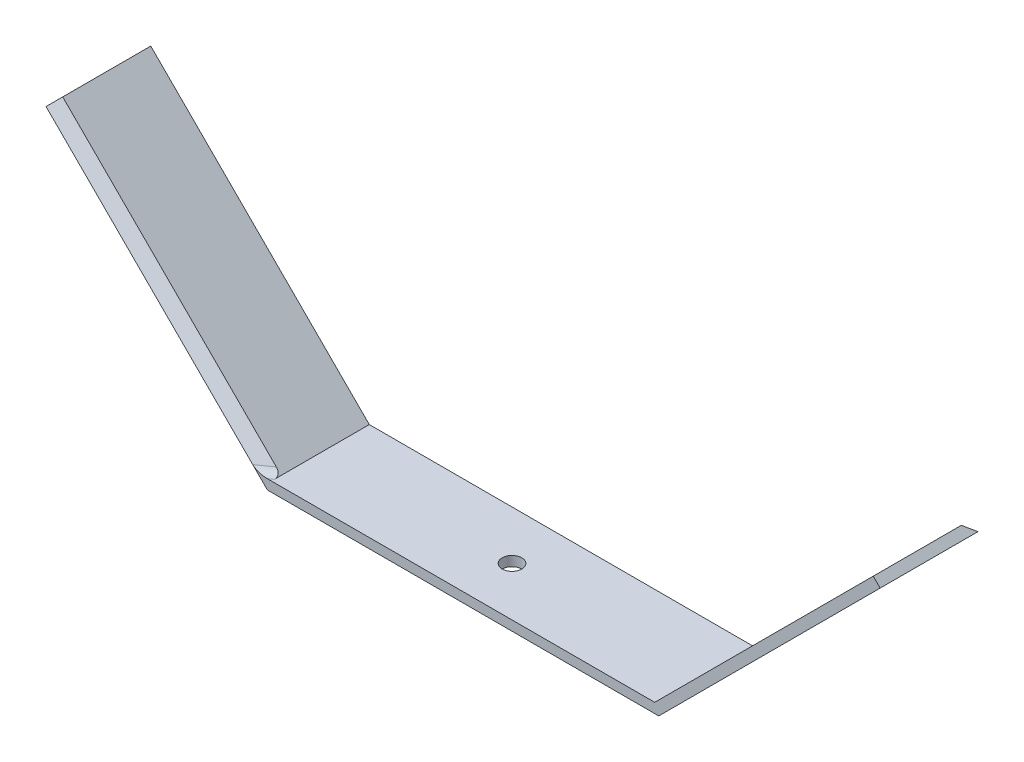
from build123d import *

# Parameters (mm, degrees)
BLADE_EXTRUDE_DEPTH        = 10
BLADE_CUT_SIZE             = 1
EDGE_ROUNDING_R            = 1
SKETCH2_R                  = 1
HOLE_FOR_SCREW_BLADE_DEPTH = 10


with BuildPart() as part:
    # Sketch1 → Blade Extrude (new body)
    with BuildSketch(Plane.XY):
        Polygon((20, 0), (-20, 0), (-42.627416998, 22.627416998), (-41.920310217, 23.334523779), (-19.585786438, 1), (19.585786438, 1), (41.920310217, 23.334523779), (42.627416998, 22.627416998), align=None)
    extrude(amount=BLADE_EXTRUDE_DEPTH)

    # Blade Cut
    blade_cut_edges = [part.edges().sort_by_distance(p)[0] for p in [
        (30.753048327, 12.16726189, 0),
        (-30.753048327, 12.16726189, 10),
    ]]
    chamfer(blade_cut_edges, length=BLADE_CUT_SIZE - 0.0001)  # a hair under: the kernel refuses the full size

    # Edge Rounding
    edge_rounding_edges = [part.edges().sort_by_distance(p)[0] for p in [
        (20.292822508, 1, 0.49995),
        (-20.292822508, 1, 9.50005),
    ]]
    fillet(edge_rounding_edges, radius=EDGE_ROUNDING_R)

    # Sketch2 → Hole for Screw (Blade) (cut)
    with BuildSketch(Plane(origin=(0, 1, 0), x_dir=(1, 0, 0), z_dir=(0, 1, 0))):
        with Locations(Location((0, -5, 0), (0, 0, 180))):
            Circle(SKETCH2_R)
    extrude(amount=-HOLE_FOR_SCREW_BLADE_DEPTH, mode=Mode.SUBTRACT)


solid = part.part
